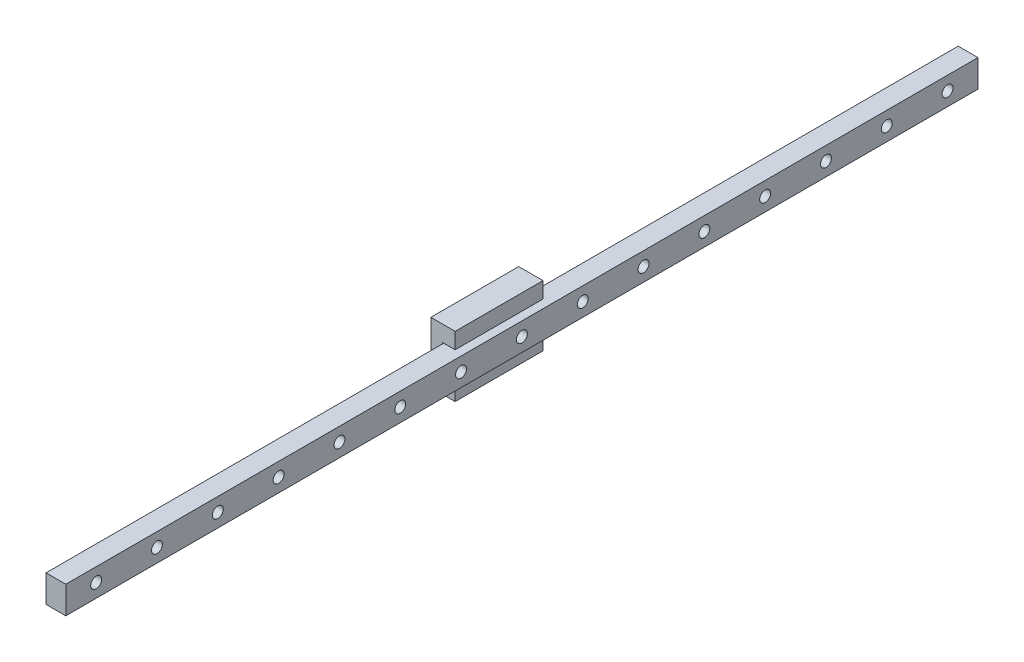
from build123d import *

# Parameters (mm, degrees)
SKETCH1_W                      = 6.5
SKETCH1_H                      = 9
BOSS_EXTRUDE1_DEPTH            = 150
BOSS_EXTRUDE2_DEPTH            = 14.45
M3X0_5_TAPPED_HOLE1_AT_2_COUNT = 2
M3X0_5_TAPPED_HOLE1_AT_2_PITCH = 18.027756377
M3X0_5_TAPPED_HOLE1_AT_3_COUNT = 2
M3X0_5_TAPPED_HOLE1_AT_3_PITCH = 15
M3X0_5_TAPPED_HOLE1_AT_4_COUNT = 2
M3X0_5_TAPPED_HOLE1_AT_4_PITCH = 10
LPATTERN1_COUNT                = 15
LPATTERN1_PITCH                = 20


with BuildPart() as part:
    # Sketch1 → Boss-Extrude1 (new, symmetric)
    with BuildSketch(Plane.XY):
        Rectangle(SKETCH1_W, SKETCH1_H)
    extrude(amount=BOSS_EXTRUDE1_DEPTH, both=True)

    # Sketch6 → CBORE for M3 SHCS1 (revolve, cut)
    with BuildSketch(Plane(origin=(-3.25, 0, -140), x_dir=(0, 0, 1), z_dir=(0, 1, 0))):
        Polygon((0, 0), (0, 6.5), (1.8, 6.5), (1.8, 3), (3.25, 3), (3.25, 0), align=None)
    cbore_for_m3_shcs1 = revolve(axis=Axis((-9.6, 0, -140), (1, 0, 0)), mode=Mode.SUBTRACT)

    # LPattern1: CBORE for M3 SHCS1 ×15
    with Locations(*[(0, 0, i * LPATTERN1_PITCH) for i in range(1, LPATTERN1_COUNT)]):
        add(cbore_for_m3_shcs1, mode=Mode.SUBTRACT)


with BuildPart() as body_2:
    # Sketch2 → Boss-Extrude2 (new, symmetric)
    with BuildSketch(Plane.XY):
        Polygon((0.75, 4.75), (0.75, 10), (-7.25, 10), (-7.25, -10), (0.75, -10), (0.75, -4.75), (-3.45, -4.75), (-3.45, 4.75), align=None)
    extrude(amount=BOSS_EXTRUDE2_DEPTH, both=True)

    # Sketch4 → M3x0.5 Tapped Hole1 (revolve, cut)
    with BuildSketch(Plane(origin=(-7.25, 7.5, -5), x_dir=(0, 0, 1), z_dir=(0, 1, 0))):
        Polygon((0, 0), (0, 3.751075774), (1.25, 3), (1.25, 0), align=None)
    m3x0_5_tapped_hole1 = revolve(axis=Axis((-13.6, 7.5, -5), (1, 0, 0)), mode=Mode.SUBTRACT)

    # M3x0.5 Tapped Hole1 at 2: M3x0.5 Tapped Hole1 ×2
    with Locations(*[Vector(0, -0.8320502943378437, 0.5547001962252291) * (i * M3X0_5_TAPPED_HOLE1_AT_2_PITCH) for i in range(1, M3X0_5_TAPPED_HOLE1_AT_2_COUNT)]):
        add(m3x0_5_tapped_hole1, mode=Mode.SUBTRACT)

    # M3x0.5 Tapped Hole1 at 3: M3x0.5 Tapped Hole1 ×2
    with Locations(*[(0, -i * M3X0_5_TAPPED_HOLE1_AT_3_PITCH, 0) for i in range(1, M3X0_5_TAPPED_HOLE1_AT_3_COUNT)]):
        add(m3x0_5_tapped_hole1, mode=Mode.SUBTRACT)

    # M3x0.5 Tapped Hole1 at 4: M3x0.5 Tapped Hole1 ×2
    with Locations(*[(0, 0, i * M3X0_5_TAPPED_HOLE1_AT_4_PITCH) for i in range(1, M3X0_5_TAPPED_HOLE1_AT_4_COUNT)]):
        add(m3x0_5_tapped_hole1, mode=Mode.SUBTRACT)


with BuildPart() as body_2_1:
    # Body-Move/Copy1: moved
    add(body_2.part.moved(Location((0, 0, 5))))


solid = Compound([part.part, body_2_1.part])
